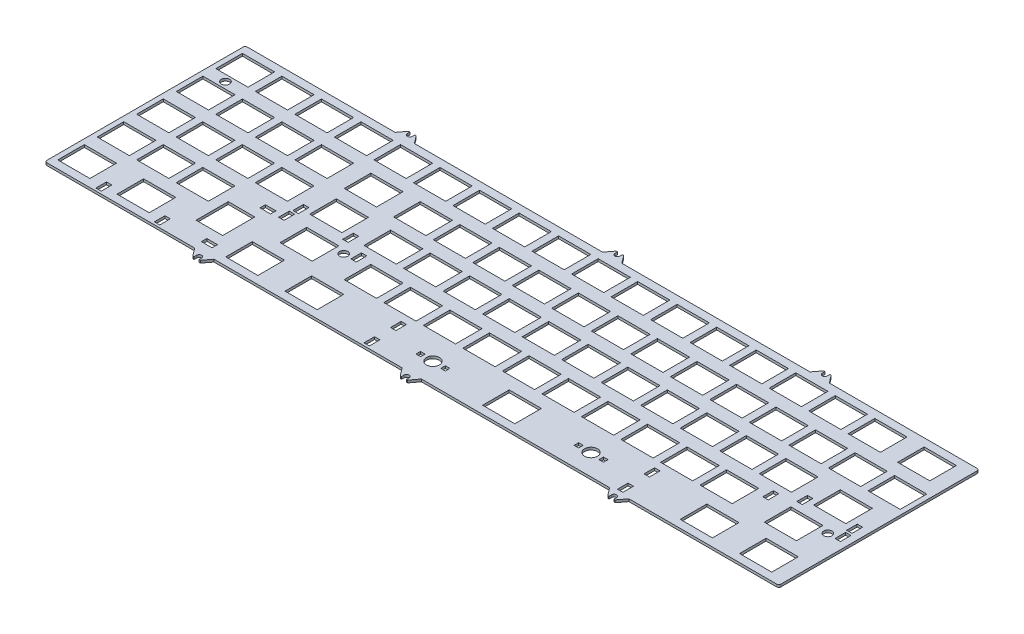
from build123d import *

# Parameters (mm, degrees)
SKETCH2_R           = 3.125
SKETCH2_R_2         = 2
SKETCH2_W           = 15.6
SKETCH2_H           = 12.8
SKETCH2_W_2         = 2.6
SKETCH2_H_2         = 5.1
SKETCH2_W_3         = 2.2
SKETCH2_H_3         = 2.2
SKETCH2_W_4         = 5.1
SKETCH2_H_4         = 2.6
SKETCH2_W_5         = 15.5
SKETCH2_W_6         = 12.8
SKETCH2_H_5         = 15.5
BOSS_EXTRUDE1_DEPTH = 1.2


with BuildPart() as part:
    # Sketch2 → Boss-Extrude1 (new body)
    with BuildSketch(Plane(origin=(0, 0, 0), x_dir=(1, 0, 0), z_dir=(0, 1, 0))):
        with BuildLine():
            Line((-4.122e-06, 4.749999815), (-4.122e-06, 99.349999815))
            ThreePointArc((-4.122e-06, 99.349999815), (0.292889097, 100.057106597), (0.999995878, 100.349999815))
            Line((0.999995878, 100.349999815), (72.237495878, 100.349999815))
            Line((72.237495878, 100.349999815), (75.087495878, 104.099999815))
            Line((75.087495878, 104.099999815), (75.687495878, 104.099999815))
            Line((75.687495878, 104.099999815), (75.687495878, 103.599999815))
            Line((75.687495878, 103.599999815), (75.687495878, 102.849999815))
            ThreePointArc((75.687495878, 102.849999815), (76.887495878, 101.649999815), (78.087495878, 102.849999815))
            Line((78.087495878, 102.849999815), (78.087495878, 103.599999815))
            Line((78.087495878, 103.599999815), (78.087495878, 104.099999815))
            Line((78.087495878, 104.099999815), (78.687495879, 104.099999815))
            Line((78.687495879, 104.099999815), (81.537495879, 100.349999815))
            Line((81.537495879, 100.349999815), (172.237495878, 100.349999815))
            Line((172.237495878, 100.349999815), (175.087495878, 104.099999815))
            Line((175.087495878, 104.099999815), (175.687495878, 104.099999815))
            Line((175.687495878, 104.099999815), (175.687495878, 102.849999815))
            ThreePointArc((175.687495878, 102.849999815), (176.887495878, 101.649999815), (178.087495878, 102.849999815))
            Line((178.087495878, 102.849999815), (178.087495878, 104.099999815))
            Line((178.087495878, 104.099999815), (178.687495878, 104.099999815))
            Line((178.687495878, 104.099999815), (181.537495878, 100.349999815))
            Line((181.537495878, 100.349999815), (272.237495878, 100.349999815))
            Line((272.237495878, 100.349999815), (275.087495878, 104.099999815))
            Line((275.087495878, 104.099999815), (275.687495878, 104.099999815))
            Line((275.687495878, 104.099999815), (275.687495878, 102.849999815))
            ThreePointArc((275.687495878, 102.849999815), (276.887495878, 101.649999815), (278.087495878, 102.849999815))
            Line((278.087495878, 102.849999815), (278.087495878, 104.099999815))
            Line((278.087495878, 104.099999815), (278.687495878, 104.099999815))
            Line((278.687495878, 104.099999815), (281.537495878, 100.349999815))
            Line((281.537495878, 100.349999815), (352.774995878, 100.349999815))
            ThreePointArc((352.774995878, 100.349999815), (353.48210266, 100.057106597), (353.774995878, 99.349999815))
            Line((353.774995878, 99.349999815), (353.774995878, 4.749999815))
            ThreePointArc((353.774995878, 4.749999815), (353.48210266, 4.042893034), (352.774995878, 3.749999815))
            Line((352.774995878, 3.749999815), (281.537495878, 3.749999815))
            Line((281.537495878, 3.749999815), (278.687495878, -1.85e-07))
            Line((278.687495878, -1.85e-07), (278.087495878, -1.85e-07))
            Line((278.087495878, -1.85e-07), (278.087495878, 1.249999815))
            ThreePointArc((278.087495878, 1.249999815), (276.887495878, 2.449999815), (275.687495878, 1.249999815))
            Line((275.687495878, 1.249999815), (275.687495878, -1.85e-07))
            Line((275.687495878, -1.85e-07), (275.087495878, -1.85e-07))
            Line((275.087495878, -1.85e-07), (272.237495878, 3.749999815))
            Line((272.237495878, 3.749999815), (181.537495878, 3.749999815))
            Line((181.537495878, 3.749999815), (178.687495878, -1.85e-07))
            Line((178.687495878, -1.85e-07), (178.087495878, -1.85e-07))
            Line((178.087495878, -1.85e-07), (178.087495878, 1.249999815))
            ThreePointArc((178.087495878, 1.249999815), (176.887495878, 2.449999815), (175.687495878, 1.249999815))
            Line((175.687495878, 1.249999815), (175.687495878, -1.85e-07))
            Line((175.687495878, -1.85e-07), (175.087495878, -1.85e-07))
            Line((175.087495878, -1.85e-07), (172.237495878, 3.749999815))
            Line((172.237495878, 3.749999815), (81.537495879, 3.749999815))
            Line((81.537495879, 3.749999815), (78.687495879, -1.85e-07))
            Line((78.687495879, -1.85e-07), (78.087495878, -1.85e-07))
            Line((78.087495878, -1.85e-07), (78.087495878, 0.499999815))
            Line((78.087495878, 0.499999815), (78.087495878, 1.249999815))
            ThreePointArc((78.087495878, 1.249999815), (76.887495878, 2.449999815), (75.687495878, 1.249999815))
            Line((75.687495878, 1.249999815), (75.687495878, 0.499999815))
            Line((75.687495878, 0.499999815), (75.687495878, -1.85e-07))
            Line((75.687495878, -1.85e-07), (75.087495878, -1.85e-07))
            Line((75.087495878, -1.85e-07), (72.237495878, 3.749999815))
            Line((72.237495878, 3.749999815), (0.999995878, 3.749999815))
            ThreePointArc((0.999995878, 3.749999815), (0.292889097, 4.042893034), (-4.122e-06, 4.749999815))
        make_face()
        with Locations((176.887495878, 13.949999815)):
            Circle(SKETCH2_R, mode=Mode.SUBTRACT)
        with Locations((253.087495878, 13.949999815)):
            Circle(SKETCH2_R, mode=Mode.SUBTRACT)
        with Locations((343.918745878, 37.249999815)):
            Circle(SKETCH2_R_2, mode=Mode.SUBTRACT)
        with Locations((110.556245878, 37.249999815)):
            Circle(SKETCH2_R_2, mode=Mode.SUBTRACT)
        with Locations((10.199995878, 80.624999815)):
            Circle(SKETCH2_R_2, mode=Mode.SUBTRACT)
        with Locations((129.262495878, 32.999999815)):
            Rectangle(SKETCH2_W, SKETCH2_H, mode=Mode.SUBTRACT)
        with Locations((119.737495878, 52.049999815)):
            Rectangle(SKETCH2_W, SKETCH2_H, mode=Mode.SUBTRACT)
        with Locations((114.974995878, 71.099999815)):
            Rectangle(SKETCH2_W, SKETCH2_H, mode=Mode.SUBTRACT)
        with Locations((324.431248691, 45.649999553)):
            Rectangle(SKETCH2_W_2, SKETCH2_H_2, mode=Mode.SUBTRACT)
        with Locations((348.431245878, 45.649999815)):
            Rectangle(SKETCH2_W_2, SKETCH2_H_2, mode=Mode.SUBTRACT)
        with Locations((105.543745878, 45.649999815)):
            Rectangle(SKETCH2_W_2, SKETCH2_H_2, mode=Mode.SUBTRACT)
        with Locations((314.268745878, 39.399999815)):
            Rectangle(SKETCH2_W_2, SKETCH2_H_2, mode=Mode.SUBTRACT)
        with Locations((349.068745878, 39.399999815)):
            Rectangle(SKETCH2_W_2, SKETCH2_H_2, mode=Mode.SUBTRACT)
        with Locations((115.706245878, 39.399999815)):
            Rectangle(SKETCH2_W_2, SKETCH2_H_2, mode=Mode.SUBTRACT)
        with Locations((153.887495878, 7.549999815)):
            Rectangle(SKETCH2_W_2, SKETCH2_H_2, mode=Mode.SUBTRACT)
        with Locations((182.862495878, 13.949999815)):
            Rectangle(SKETCH2_W_3, SKETCH2_H_3, mode=Mode.SUBTRACT)
        with Locations((170.912495878, 13.949999815)):
            Rectangle(SKETCH2_W_3, SKETCH2_H_3, mode=Mode.SUBTRACT)
        with Locations((247.112495878, 13.949999815)):
            Rectangle(SKETCH2_W_3, SKETCH2_H_3, mode=Mode.SUBTRACT)
        with Locations((259.062495878, 13.949999815)):
            Rectangle(SKETCH2_W_3, SKETCH2_H_3, mode=Mode.SUBTRACT)
        with Locations((81.543748691, 45.649999553)):
            Rectangle(SKETCH2_W_2, SKETCH2_H_2, mode=Mode.SUBTRACT)
        with Locations((80.906245878, 39.399999815)):
            Rectangle(SKETCH2_W_2, SKETCH2_H_2, mode=Mode.SUBTRACT)
        with Locations((24.674995878, 7.549999815)):
            Rectangle(SKETCH2_W_2, SKETCH2_H_2, mode=Mode.SUBTRACT)
        with Locations((52.874995878, 7.549999815)):
            Rectangle(SKETCH2_W_2, SKETCH2_H_2, mode=Mode.SUBTRACT)
        with Locations((73.749995878, 9.374999815)):
            Rectangle(SKETCH2_W_4, SKETCH2_H_4, mode=Mode.SUBTRACT)
        with Locations((73.749995878, 37.574999815)):
            Rectangle(SKETCH2_W_4, SKETCH2_H_4, mode=Mode.SUBTRACT)
        with Locations((153.887495878, 20.349999815)):
            Rectangle(SKETCH2_W_2, SKETCH2_H_2, mode=Mode.SUBTRACT)
        with Locations((276.087495878, 20.349999815)):
            Rectangle(SKETCH2_W_2, SKETCH2_H_2, mode=Mode.SUBTRACT)
        with Locations((276.087495878, 7.549999815)):
            Rectangle(SKETCH2_W_2, SKETCH2_H_2, mode=Mode.SUBTRACT)
        with Locations((338.812495878, 90.149999815)):
            Rectangle(SKETCH2_W_5, SKETCH2_H, mode=Mode.SUBTRACT)
        with Locations((314.999995878, 90.149999815)):
            Rectangle(SKETCH2_W_5, SKETCH2_H, mode=Mode.SUBTRACT)
        with Locations((295.949995878, 90.149999815)):
            Rectangle(SKETCH2_W_5, SKETCH2_H, mode=Mode.SUBTRACT)
        with Locations((276.899995878, 90.149999815)):
            Rectangle(SKETCH2_W_5, SKETCH2_H, mode=Mode.SUBTRACT)
        with Locations((257.849995878, 90.149999815)):
            Rectangle(SKETCH2_W_5, SKETCH2_H, mode=Mode.SUBTRACT)
        with Locations((238.799995878, 90.149999815)):
            Rectangle(SKETCH2_W_5, SKETCH2_H, mode=Mode.SUBTRACT)
        with Locations((219.749995878, 90.149999815)):
            Rectangle(SKETCH2_W_5, SKETCH2_H, mode=Mode.SUBTRACT)
        with Locations((200.699995878, 90.149999815)):
            Rectangle(SKETCH2_W_5, SKETCH2_H, mode=Mode.SUBTRACT)
        with Locations((181.649995878, 90.149999815)):
            Rectangle(SKETCH2_W_5, SKETCH2_H, mode=Mode.SUBTRACT)
        with Locations((162.599995878, 90.149999815)):
            Rectangle(SKETCH2_W_5, SKETCH2_H, mode=Mode.SUBTRACT)
        with Locations((143.549995878, 90.149999815)):
            Rectangle(SKETCH2_W_5, SKETCH2_H, mode=Mode.SUBTRACT)
        with Locations((124.499995878, 90.149999815)):
            Rectangle(SKETCH2_W_5, SKETCH2_H, mode=Mode.SUBTRACT)
        with Locations((105.449995878, 90.149999815)):
            Rectangle(SKETCH2_W_5, SKETCH2_H, mode=Mode.SUBTRACT)
        with Locations((86.399995878, 90.149999815)):
            Rectangle(SKETCH2_W_5, SKETCH2_H, mode=Mode.SUBTRACT)
        with Locations((67.349995878, 71.099999815)):
            Rectangle(SKETCH2_W_5, SKETCH2_H, mode=Mode.SUBTRACT)
        with Locations((67.349995878, 90.149999815)):
            Rectangle(SKETCH2_W_5, SKETCH2_H, mode=Mode.SUBTRACT)
        with Locations((48.299995878, 71.099999815)):
            Rectangle(SKETCH2_W_5, SKETCH2_H, mode=Mode.SUBTRACT)
        with Locations((48.299995878, 90.149999815)):
            Rectangle(SKETCH2_W_5, SKETCH2_H, mode=Mode.SUBTRACT)
        with Locations((29.249995878, 71.099999815)):
            Rectangle(SKETCH2_W_5, SKETCH2_H, mode=Mode.SUBTRACT)
        with Locations((29.249995878, 90.149999815)):
            Rectangle(SKETCH2_W_5, SKETCH2_H, mode=Mode.SUBTRACT)
        with Locations((10.199995878, 71.099999815)):
            Rectangle(SKETCH2_W_5, SKETCH2_H, mode=Mode.SUBTRACT)
        with Locations((10.199995878, 90.149999815)):
            Rectangle(SKETCH2_W_5, SKETCH2_H, mode=Mode.SUBTRACT)
        with Locations((67.299995878, 52.049999815)):
            Rectangle(SKETCH2_W_5, SKETCH2_H, mode=Mode.SUBTRACT)
        with Locations((48.249995878, 52.049999815)):
            Rectangle(SKETCH2_W_5, SKETCH2_H, mode=Mode.SUBTRACT)
        with Locations((29.199995878, 52.049999815)):
            Rectangle(SKETCH2_W_5, SKETCH2_H, mode=Mode.SUBTRACT)
        with Locations((10.149995878, 52.049999815)):
            Rectangle(SKETCH2_W_5, SKETCH2_H, mode=Mode.SUBTRACT)
        with Locations((48.249995878, 32.999999815)):
            Rectangle(SKETCH2_W_5, SKETCH2_H, mode=Mode.SUBTRACT)
        with Locations((29.199995878, 32.999999815)):
            Rectangle(SKETCH2_W_5, SKETCH2_H, mode=Mode.SUBTRACT)
        with Locations((10.149995878, 32.999999815)):
            Rectangle(SKETCH2_W_5, SKETCH2_H, mode=Mode.SUBTRACT)
        with Locations((10.199995878, 13.949999815)):
            Rectangle(SKETCH2_W_5, SKETCH2_H, mode=Mode.SUBTRACT)
        with Locations((38.774995878, 13.949999815)):
            Rectangle(SKETCH2_W_5, SKETCH2_H, mode=Mode.SUBTRACT)
        with Locations((91.162495878, 13.949999815)):
            Rectangle(SKETCH2_W_5, SKETCH2_H, mode=Mode.SUBTRACT)
        with Locations((119.737495878, 13.949999815)):
            Rectangle(SKETCH2_W_5, SKETCH2_H, mode=Mode.SUBTRACT)
        with Locations((98.306245878, 32.999999815)):
            Rectangle(SKETCH2_W_5, SKETCH2_H, mode=Mode.SUBTRACT)
        with Locations((93.543745878, 52.049999815)):
            Rectangle(SKETCH2_W_5, SKETCH2_H, mode=Mode.SUBTRACT)
        with Locations((91.162495878, 71.099999815)):
            Rectangle(SKETCH2_W_5, SKETCH2_H, mode=Mode.SUBTRACT)
        with Locations((336.431245878, 52.049999815)):
            Rectangle(SKETCH2_W_5, SKETCH2_H, mode=Mode.SUBTRACT)
        with Locations((214.987495878, 13.949999815)):
            Rectangle(SKETCH2_W_5, SKETCH2_H, mode=Mode.SUBTRACT)
        with Locations((310.237495879, 13.949999815)):
            Rectangle(SKETCH2_W_5, SKETCH2_H, mode=Mode.SUBTRACT)
        with Locations((331.668745878, 32.999999815)):
            Rectangle(SKETCH2_W_5, SKETCH2_H, mode=Mode.SUBTRACT)
        with Locations((338.812495879, 13.949999815)):
            Rectangle(SKETCH2_W_5, SKETCH2_H, mode=Mode.SUBTRACT)
        with Locations((67.349995878, 23.474999815)):
            Rectangle(SKETCH2_W_6, SKETCH2_H_5, mode=Mode.SUBTRACT)
        with Locations((286.424995878, 71.099999815)):
            Rectangle(SKETCH2_W_5, SKETCH2_H, mode=Mode.SUBTRACT)
        with Locations((267.374995878, 71.099999815)):
            Rectangle(SKETCH2_W_5, SKETCH2_H, mode=Mode.SUBTRACT)
        with Locations((248.324995878, 71.099999815)):
            Rectangle(SKETCH2_W_5, SKETCH2_H, mode=Mode.SUBTRACT)
        with Locations((229.274995878, 71.099999815)):
            Rectangle(SKETCH2_W_5, SKETCH2_H, mode=Mode.SUBTRACT)
        with Locations((210.224995878, 71.099999815)):
            Rectangle(SKETCH2_W_5, SKETCH2_H, mode=Mode.SUBTRACT)
        with Locations((191.174995878, 71.099999815)):
            Rectangle(SKETCH2_W_5, SKETCH2_H, mode=Mode.SUBTRACT)
        with Locations((172.124995878, 71.099999815)):
            Rectangle(SKETCH2_W_5, SKETCH2_H, mode=Mode.SUBTRACT)
        with Locations((153.074995878, 71.099999815)):
            Rectangle(SKETCH2_W_5, SKETCH2_H, mode=Mode.SUBTRACT)
        with Locations((134.024995878, 71.099999815)):
            Rectangle(SKETCH2_W_5, SKETCH2_H, mode=Mode.SUBTRACT)
        with Locations((291.187495878, 52.049999815)):
            Rectangle(SKETCH2_W_5, SKETCH2_H, mode=Mode.SUBTRACT)
        with Locations((272.137495878, 52.049999815)):
            Rectangle(SKETCH2_W_5, SKETCH2_H, mode=Mode.SUBTRACT)
        with Locations((253.087495878, 52.049999815)):
            Rectangle(SKETCH2_W_5, SKETCH2_H, mode=Mode.SUBTRACT)
        with Locations((234.037495878, 52.049999815)):
            Rectangle(SKETCH2_W_5, SKETCH2_H, mode=Mode.SUBTRACT)
        with Locations((214.987495878, 52.049999815)):
            Rectangle(SKETCH2_W_5, SKETCH2_H, mode=Mode.SUBTRACT)
        with Locations((195.937495878, 52.049999815)):
            Rectangle(SKETCH2_W_5, SKETCH2_H, mode=Mode.SUBTRACT)
        with Locations((176.887495878, 52.049999815)):
            Rectangle(SKETCH2_W_5, SKETCH2_H, mode=Mode.SUBTRACT)
        with Locations((157.837495878, 52.049999815)):
            Rectangle(SKETCH2_W_5, SKETCH2_H, mode=Mode.SUBTRACT)
        with Locations((138.787495878, 52.049999815)):
            Rectangle(SKETCH2_W_5, SKETCH2_H, mode=Mode.SUBTRACT)
        with Locations((300.712495878, 32.999999815)):
            Rectangle(SKETCH2_W_5, SKETCH2_H, mode=Mode.SUBTRACT)
        with Locations((281.662495878, 32.999999815)):
            Rectangle(SKETCH2_W_5, SKETCH2_H, mode=Mode.SUBTRACT)
        with Locations((262.612495878, 32.999999815)):
            Rectangle(SKETCH2_W_5, SKETCH2_H, mode=Mode.SUBTRACT)
        with Locations((243.562495878, 32.999999815)):
            Rectangle(SKETCH2_W_5, SKETCH2_H, mode=Mode.SUBTRACT)
        with Locations((224.512495878, 32.999999815)):
            Rectangle(SKETCH2_W_5, SKETCH2_H, mode=Mode.SUBTRACT)
        with Locations((205.462495878, 32.999999815)):
            Rectangle(SKETCH2_W_5, SKETCH2_H, mode=Mode.SUBTRACT)
        with Locations((186.412495878, 32.999999815)):
            Rectangle(SKETCH2_W_5, SKETCH2_H, mode=Mode.SUBTRACT)
        with Locations((167.362495878, 32.999999815)):
            Rectangle(SKETCH2_W_5, SKETCH2_H, mode=Mode.SUBTRACT)
        with Locations((148.312495878, 32.999999815)):
            Rectangle(SKETCH2_W_5, SKETCH2_H, mode=Mode.SUBTRACT)
        with Locations((343.574995878, 71.099999815)):
            Rectangle(SKETCH2_W_5, SKETCH2_H, mode=Mode.SUBTRACT)
        with Locations((324.524995878, 71.099999815)):
            Rectangle(SKETCH2_W_5, SKETCH2_H, mode=Mode.SUBTRACT)
        with Locations((305.474995878, 71.099999815)):
            Rectangle(SKETCH2_W_5, SKETCH2_H, mode=Mode.SUBTRACT)
        with Locations((310.237495878, 52.049999815)):
            Rectangle(SKETCH2_W_5, SKETCH2_H, mode=Mode.SUBTRACT)
    extrude(amount=-BOSS_EXTRUDE1_DEPTH)


solid = part.part
